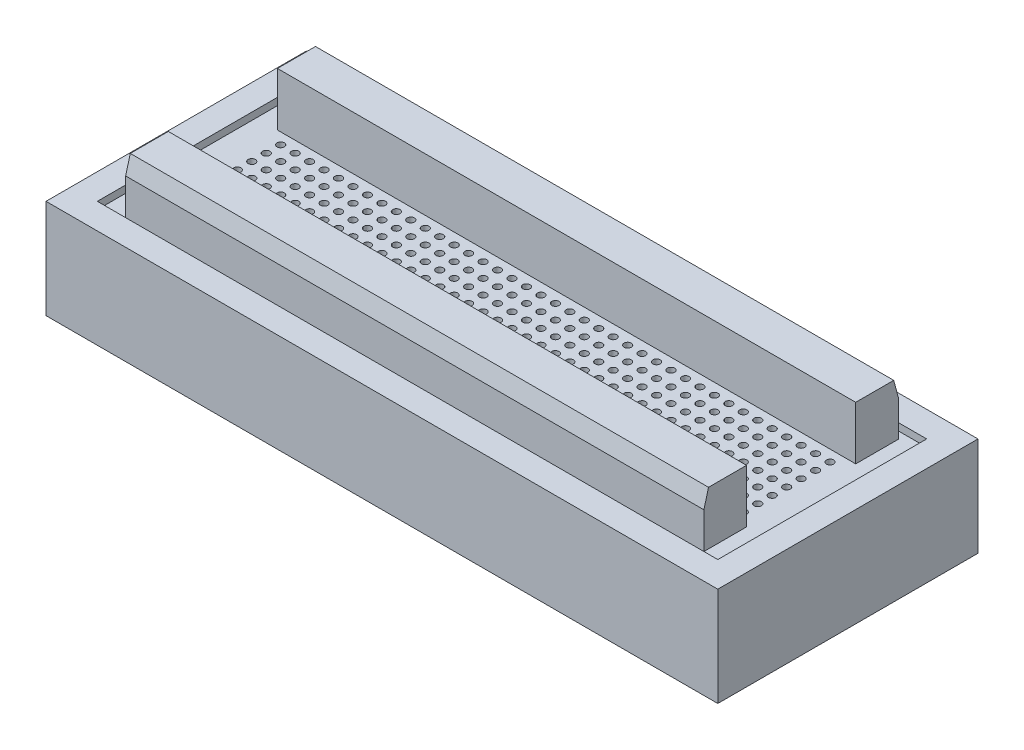
from build123d import *

# Parameters (mm, degrees)
SKETCH1_W               = 118.0338
SKETCH1_H               = 45.72
BOSS_EXTRUDE1_DEPTH     = 17.399
SKETCH2_W               = 109.0168
SKETCH2_H               = 36.703
CUT_EXTRUDE1_DEPTH      = 1.27
BOSS_EXTRUDE2_DEPTH     = 50.8
SKETCH5_W               = 109.0168
SKETCH5_H               = 36.703
CUT_EXTRUDE2_DEPTH      = 66.312469917
SKETCH5_2_W             = 109.0168
SKETCH5_2_H             = 36.703
BOSS_EXTRUDE3_DEPTH     = 16.129
FILL_PATTERN2_OUTLINE_R = 0.635
FILL_PATTERN2_DEPTH     = 16.129


# Read off the part's stored shape, not the designer's step: Fill Pattern2
with BuildPart() as part:
    # Sketch1 → Boss-Extrude1 (new body)
    with BuildSketch(Plane(origin=(0, 0, 0), x_dir=(1, 0, 0), z_dir=(0, 1, 0))):
        Rectangle(SKETCH1_W, SKETCH1_H)
    extrude(amount=BOSS_EXTRUDE1_DEPTH)

    # Sketch2 → Cut-Extrude1 (cut)
    with BuildSketch(Plane(origin=(0, 17.399, 0), x_dir=(1, 0, 0), z_dir=(0, 1, 0))):
        Rectangle(SKETCH2_W, SKETCH2_H)
    extrude(amount=-CUT_EXTRUDE1_DEPTH, mode=Mode.SUBTRACT)

    # Sketch3 → Boss-Extrude2 (add, symmetric)
    with BuildSketch(Plane(origin=(0, 0, 0), x_dir=(0, 0, -1), z_dir=(1, 0, 0))):
        Polygon((-9.5885, 16.129), (-9.5885, 25.5016), (-16.271596771, 25.5016), (-17.0815, 22.479), (-17.0815, 16.129), align=None)
    boss_extrude2 = extrude(amount=BOSS_EXTRUDE2_DEPTH, both=True)

    # Mirror1: Boss-Extrude2 across plane
    add(boss_extrude2.mirror(Plane.XY))

    # Sketch5 → Cut-Extrude2 (cut, through all)
    with BuildSketch(Plane(origin=(0, 16.129, 0), x_dir=(1, 0, 0), z_dir=(0, 1, 0))):
        Rectangle(SKETCH5_W, SKETCH5_H)
    extrude(amount=-CUT_EXTRUDE2_DEPTH, mode=Mode.SUBTRACT)


with BuildPart() as cut_extrude2_piece_1:
    # of the separate pieces the step leaves, piece 1, a body of its own (cut_extrude2_pieces)
    add(part.part.solids().sort_by_distance((-59.0169, 0, 22.86))[0])


with BuildPart() as cut_extrude2_piece_2:
    # of the separate pieces the step leaves, piece 2, a body of its own (cut_extrude2_pieces)
    add(part.part.solids().sort_by_distance((50.8, 16.129, -9.5885))[0])


with BuildPart() as cut_extrude2_piece_3:
    # of the separate pieces the step leaves, piece 3, a body of its own (cut_extrude2_pieces)
    add(part.part.solids().sort_by_distance((-50.8, 16.129, 9.5885))[0])


with BuildPart() as body_4:
    # Sketch5<2> → Boss-Extrude3 (new body)
    with BuildSketch(Plane(origin=(0, 16.129, 0), x_dir=(1, 0, 0), z_dir=(0, 1, 0))):
        Rectangle(SKETCH5_2_W, SKETCH5_2_H)
    extrude(amount=-BOSS_EXTRUDE3_DEPTH)

    # Fill Pattern2 outline → Fill Pattern2 (cut)
    with BuildSketch(Plane(origin=(0, 0, 0), x_dir=(1, 0, 0), z_dir=(0, 1, 0))):
        Circle(FILL_PATTERN2_OUTLINE_R)
        with Locations((-45.72, 5.08)):
            Circle(FILL_PATTERN2_OUTLINE_R)
        with Locations((-45.72, 2.54)):
            Circle(FILL_PATTERN2_OUTLINE_R)
        with Locations((-45.72, 0)):
            Circle(FILL_PATTERN2_OUTLINE_R)
        with Locations((-45.72, -2.54)):
            Circle(FILL_PATTERN2_OUTLINE_R)
        with Locations((-43.18, 5.08)):
            Circle(FILL_PATTERN2_OUTLINE_R)
        with Locations((-45.72, -7.62)):
            Circle(FILL_PATTERN2_OUTLINE_R)
        with Locations((-43.18, 7.62)):
            Circle(FILL_PATTERN2_OUTLINE_R)
        with Locations((-45.72, -5.08)):
            Circle(FILL_PATTERN2_OUTLINE_R)
        with Locations((-48.26, 7.62)):
            Circle(FILL_PATTERN2_OUTLINE_R)
        with Locations((-48.26, 5.08)):
            Circle(FILL_PATTERN2_OUTLINE_R)
        with Locations((-48.26, 2.54)):
            Circle(FILL_PATTERN2_OUTLINE_R)
        with Locations((-48.26, 0)):
            Circle(FILL_PATTERN2_OUTLINE_R)
        with Locations((-48.26, -7.62)):
            Circle(FILL_PATTERN2_OUTLINE_R)
        with Locations((-45.72, 7.62)):
            Circle(FILL_PATTERN2_OUTLINE_R)
        with Locations((-48.26, -5.08)):
            Circle(FILL_PATTERN2_OUTLINE_R)
        with Locations((-48.26, -2.54)):
            Circle(FILL_PATTERN2_OUTLINE_R)
        with Locations((-5.08, -7.62)):
            Circle(FILL_PATTERN2_OUTLINE_R)
        with Locations((20.32, -7.62)):
            Circle(FILL_PATTERN2_OUTLINE_R)
        with Locations((22.86, -5.08)):
            Circle(FILL_PATTERN2_OUTLINE_R)
        with Locations((25.4, -2.54)):
            Circle(FILL_PATTERN2_OUTLINE_R)
        with Locations((27.94, 0)):
            Circle(FILL_PATTERN2_OUTLINE_R)
        with Locations((30.48, 2.54)):
            Circle(FILL_PATTERN2_OUTLINE_R)
        with Locations((33.02, 5.08)):
            Circle(FILL_PATTERN2_OUTLINE_R)
        with Locations((35.56, 7.62)):
            Circle(FILL_PATTERN2_OUTLINE_R)
        with Locations((-5.08, 5.08)):
            Circle(FILL_PATTERN2_OUTLINE_R)
        with Locations((-7.62, -7.62)):
            Circle(FILL_PATTERN2_OUTLINE_R)
        with Locations((22.86, -7.62)):
            Circle(FILL_PATTERN2_OUTLINE_R)
        with Locations((25.4, -5.08)):
            Circle(FILL_PATTERN2_OUTLINE_R)
        with Locations((27.94, -2.54)):
            Circle(FILL_PATTERN2_OUTLINE_R)
        with Locations((30.48, 0)):
            Circle(FILL_PATTERN2_OUTLINE_R)
        with Locations((33.02, 2.54)):
            Circle(FILL_PATTERN2_OUTLINE_R)
        with Locations((35.56, 5.08)):
            Circle(FILL_PATTERN2_OUTLINE_R)
        with Locations((-2.54, -7.62)):
            Circle(FILL_PATTERN2_OUTLINE_R)
        with Locations((-5.08, 0)):
            Circle(FILL_PATTERN2_OUTLINE_R)
        with Locations((30.48, 7.62)):
            Circle(FILL_PATTERN2_OUTLINE_R)
        with Locations((27.94, 5.08)):
            Circle(FILL_PATTERN2_OUTLINE_R)
        with Locations((25.4, 2.54)):
            Circle(FILL_PATTERN2_OUTLINE_R)
        with Locations((22.86, 0)):
            Circle(FILL_PATTERN2_OUTLINE_R)
        with Locations((20.32, -2.54)):
            Circle(FILL_PATTERN2_OUTLINE_R)
        with Locations((17.78, -5.08)):
            Circle(FILL_PATTERN2_OUTLINE_R)
        with Locations((17.78, -7.62)):
            Circle(FILL_PATTERN2_OUTLINE_R)
        with Locations((20.32, -5.08)):
            Circle(FILL_PATTERN2_OUTLINE_R)
        with Locations((22.86, -2.54)):
            Circle(FILL_PATTERN2_OUTLINE_R)
        with Locations((25.4, 0)):
            Circle(FILL_PATTERN2_OUTLINE_R)
        with Locations((-5.08, 2.54)):
            Circle(FILL_PATTERN2_OUTLINE_R)
        with Locations((33.02, 7.62)):
            Circle(FILL_PATTERN2_OUTLINE_R)
        with Locations((30.48, 5.08)):
            Circle(FILL_PATTERN2_OUTLINE_R)
        with Locations((27.94, 2.54)):
            Circle(FILL_PATTERN2_OUTLINE_R)
        with Locations((2.54, 5.08)):
            Circle(FILL_PATTERN2_OUTLINE_R)
        with Locations((43.18, 7.62)):
            Circle(FILL_PATTERN2_OUTLINE_R)
        with Locations((40.64, 5.08)):
            Circle(FILL_PATTERN2_OUTLINE_R)
        with Locations((38.1, 2.54)):
            Circle(FILL_PATTERN2_OUTLINE_R)
        with Locations((-7.62, 0)):
            Circle(FILL_PATTERN2_OUTLINE_R)
        with Locations((30.48, -7.62)):
            Circle(FILL_PATTERN2_OUTLINE_R)
        with Locations((33.02, -5.08)):
            Circle(FILL_PATTERN2_OUTLINE_R)
        with Locations((35.56, -2.54)):
            Circle(FILL_PATTERN2_OUTLINE_R)
        with Locations((38.1, -2.54)):
            Circle(FILL_PATTERN2_OUTLINE_R)
        with Locations((35.56, -5.08)):
            Circle(FILL_PATTERN2_OUTLINE_R)
        with Locations((33.02, -7.62)):
            Circle(FILL_PATTERN2_OUTLINE_R)
        with Locations((-7.62, 2.54)):
            Circle(FILL_PATTERN2_OUTLINE_R)
        with Locations((45.72, 7.62)):
            Circle(FILL_PATTERN2_OUTLINE_R)
        with Locations((43.18, 5.08)):
            Circle(FILL_PATTERN2_OUTLINE_R)
        with Locations((40.64, 2.54)):
            Circle(FILL_PATTERN2_OUTLINE_R)
        with Locations((38.1, 0)):
            Circle(FILL_PATTERN2_OUTLINE_R)
        with Locations((35.56, 2.54)):
            Circle(FILL_PATTERN2_OUTLINE_R)
        with Locations((33.02, 0)):
            Circle(FILL_PATTERN2_OUTLINE_R)
        with Locations((30.48, -2.54)):
            Circle(FILL_PATTERN2_OUTLINE_R)
        with Locations((27.94, -5.08)):
            Circle(FILL_PATTERN2_OUTLINE_R)
        with Locations((25.4, -7.62)):
            Circle(FILL_PATTERN2_OUTLINE_R)
        with Locations((-7.62, -5.08)):
            Circle(FILL_PATTERN2_OUTLINE_R)
        with Locations((-2.54, 5.08)):
            Circle(FILL_PATTERN2_OUTLINE_R)
        with Locations((38.1, 7.62)):
            Circle(FILL_PATTERN2_OUTLINE_R)
        with Locations((35.56, 0)):
            Circle(FILL_PATTERN2_OUTLINE_R)
        with Locations((33.02, -2.54)):
            Circle(FILL_PATTERN2_OUTLINE_R)
        with Locations((30.48, -5.08)):
            Circle(FILL_PATTERN2_OUTLINE_R)
        with Locations((27.94, -7.62)):
            Circle(FILL_PATTERN2_OUTLINE_R)
        with Locations((-7.62, -2.54)):
            Circle(FILL_PATTERN2_OUTLINE_R)
        with Locations((0, 5.08)):
            Circle(FILL_PATTERN2_OUTLINE_R)
        with Locations((40.64, 7.62)):
            Circle(FILL_PATTERN2_OUTLINE_R)
        with Locations((38.1, 5.08)):
            Circle(FILL_PATTERN2_OUTLINE_R)
        with Locations((15.24, 5.08)):
            Circle(FILL_PATTERN2_OUTLINE_R)
        with Locations((12.7, 2.54)):
            Circle(FILL_PATTERN2_OUTLINE_R)
        with Locations((10.16, 0)):
            Circle(FILL_PATTERN2_OUTLINE_R)
        with Locations((7.62, -2.54)):
            Circle(FILL_PATTERN2_OUTLINE_R)
        with Locations((5.08, -5.08)):
            Circle(FILL_PATTERN2_OUTLINE_R)
        with Locations((-2.54, -2.54)):
            Circle(FILL_PATTERN2_OUTLINE_R)
        with Locations((15.24, 7.62)):
            Circle(FILL_PATTERN2_OUTLINE_R)
        with Locations((12.7, 5.08)):
            Circle(FILL_PATTERN2_OUTLINE_R)
        with Locations((17.78, 5.08)):
            Circle(FILL_PATTERN2_OUTLINE_R)
        with Locations((15.24, 2.54)):
            Circle(FILL_PATTERN2_OUTLINE_R)
        with Locations((12.7, 0)):
            Circle(FILL_PATTERN2_OUTLINE_R)
        with Locations((10.16, -2.54)):
            Circle(FILL_PATTERN2_OUTLINE_R)
        with Locations((7.62, -5.08)):
            Circle(FILL_PATTERN2_OUTLINE_R)
        with Locations((2.54, -5.08)):
            Circle(FILL_PATTERN2_OUTLINE_R)
        with Locations((-2.54, 0)):
            Circle(FILL_PATTERN2_OUTLINE_R)
        with Locations((17.78, 7.62)):
            Circle(FILL_PATTERN2_OUTLINE_R)
        with Locations((5.08, 2.54)):
            Circle(FILL_PATTERN2_OUTLINE_R)
        with Locations((7.62, 5.08)):
            Circle(FILL_PATTERN2_OUTLINE_R)
        with Locations((10.16, 7.62)):
            Circle(FILL_PATTERN2_OUTLINE_R)
        with Locations((2.54, -2.54)):
            Circle(FILL_PATTERN2_OUTLINE_R)
        with Locations((2.54, 2.54)):
            Circle(FILL_PATTERN2_OUTLINE_R)
        with Locations((5.08, 5.08)):
            Circle(FILL_PATTERN2_OUTLINE_R)
        with Locations((7.62, 7.62)):
            Circle(FILL_PATTERN2_OUTLINE_R)
        with Locations((2.54, 0)):
            Circle(FILL_PATTERN2_OUTLINE_R)
        with Locations((10.16, 2.54)):
            Circle(FILL_PATTERN2_OUTLINE_R)
        with Locations((7.62, 0)):
            Circle(FILL_PATTERN2_OUTLINE_R)
        with Locations((5.08, -2.54)):
            Circle(FILL_PATTERN2_OUTLINE_R)
        with Locations((0, -2.54)):
            Circle(FILL_PATTERN2_OUTLINE_R)
        with Locations((12.7, 7.62)):
            Circle(FILL_PATTERN2_OUTLINE_R)
        with Locations((10.16, 5.08)):
            Circle(FILL_PATTERN2_OUTLINE_R)
        with Locations((7.62, 2.54)):
            Circle(FILL_PATTERN2_OUTLINE_R)
        with Locations((5.08, 0)):
            Circle(FILL_PATTERN2_OUTLINE_R)
        with Locations((17.78, 0)):
            Circle(FILL_PATTERN2_OUTLINE_R)
        with Locations((20.32, 2.54)):
            Circle(FILL_PATTERN2_OUTLINE_R)
        with Locations((22.86, 5.08)):
            Circle(FILL_PATTERN2_OUTLINE_R)
        with Locations((25.4, 7.62)):
            Circle(FILL_PATTERN2_OUTLINE_R)
        with Locations((-5.08, -5.08)):
            Circle(FILL_PATTERN2_OUTLINE_R)
        with Locations((2.54, -7.62)):
            Circle(FILL_PATTERN2_OUTLINE_R)
        with Locations((12.7, -7.62)):
            Circle(FILL_PATTERN2_OUTLINE_R)
        with Locations((15.24, -5.08)):
            Circle(FILL_PATTERN2_OUTLINE_R)
        with Locations((15.24, -7.62)):
            Circle(FILL_PATTERN2_OUTLINE_R)
        with Locations((0, -7.62)):
            Circle(FILL_PATTERN2_OUTLINE_R)
        with Locations((-5.08, -2.54)):
            Circle(FILL_PATTERN2_OUTLINE_R)
        with Locations((27.94, 7.62)):
            Circle(FILL_PATTERN2_OUTLINE_R)
        with Locations((25.4, 5.08)):
            Circle(FILL_PATTERN2_OUTLINE_R)
        with Locations((22.86, 2.54)):
            Circle(FILL_PATTERN2_OUTLINE_R)
        with Locations((20.32, 0)):
            Circle(FILL_PATTERN2_OUTLINE_R)
        with Locations((17.78, -2.54)):
            Circle(FILL_PATTERN2_OUTLINE_R)
        with Locations((17.78, 2.54)):
            Circle(FILL_PATTERN2_OUTLINE_R)
        with Locations((15.24, 0)):
            Circle(FILL_PATTERN2_OUTLINE_R)
        with Locations((12.7, -2.54)):
            Circle(FILL_PATTERN2_OUTLINE_R)
        with Locations((10.16, -5.08)):
            Circle(FILL_PATTERN2_OUTLINE_R)
        with Locations((7.62, -7.62)):
            Circle(FILL_PATTERN2_OUTLINE_R)
        with Locations((0, -5.08)):
            Circle(FILL_PATTERN2_OUTLINE_R)
        with Locations((-2.54, 2.54)):
            Circle(FILL_PATTERN2_OUTLINE_R)
        with Locations((20.32, 7.62)):
            Circle(FILL_PATTERN2_OUTLINE_R)
        with Locations((15.24, -2.54)):
            Circle(FILL_PATTERN2_OUTLINE_R)
        with Locations((12.7, -5.08)):
            Circle(FILL_PATTERN2_OUTLINE_R)
        with Locations((10.16, -7.62)):
            Circle(FILL_PATTERN2_OUTLINE_R)
        with Locations((5.08, -7.62)):
            Circle(FILL_PATTERN2_OUTLINE_R)
        with Locations((-2.54, -5.08)):
            Circle(FILL_PATTERN2_OUTLINE_R)
        with Locations((0, 2.54)):
            Circle(FILL_PATTERN2_OUTLINE_R)
        with Locations((22.86, 7.62)):
            Circle(FILL_PATTERN2_OUTLINE_R)
        with Locations((20.32, 5.08)):
            Circle(FILL_PATTERN2_OUTLINE_R)
        with Locations((-27.94, 0)):
            Circle(FILL_PATTERN2_OUTLINE_R)
        with Locations((-27.94, 2.54)):
            Circle(FILL_PATTERN2_OUTLINE_R)
        with Locations((-27.94, 5.08)):
            Circle(FILL_PATTERN2_OUTLINE_R)
        with Locations((-30.48, -7.62)):
            Circle(FILL_PATTERN2_OUTLINE_R)
        with Locations((-27.94, -7.62)):
            Circle(FILL_PATTERN2_OUTLINE_R)
        with Locations((-25.4, 7.62)):
            Circle(FILL_PATTERN2_OUTLINE_R)
        with Locations((-27.94, -5.08)):
            Circle(FILL_PATTERN2_OUTLINE_R)
        with Locations((-27.94, -2.54)):
            Circle(FILL_PATTERN2_OUTLINE_R)
        with Locations((-30.48, 2.54)):
            Circle(FILL_PATTERN2_OUTLINE_R)
        with Locations((-30.48, 5.08)):
            Circle(FILL_PATTERN2_OUTLINE_R)
        with Locations((-33.02, -7.62)):
            Circle(FILL_PATTERN2_OUTLINE_R)
        with Locations((-30.48, 7.62)):
            Circle(FILL_PATTERN2_OUTLINE_R)
        with Locations((-27.94, 7.62)):
            Circle(FILL_PATTERN2_OUTLINE_R)
        with Locations((-30.48, -5.08)):
            Circle(FILL_PATTERN2_OUTLINE_R)
        with Locations((-30.48, -2.54)):
            Circle(FILL_PATTERN2_OUTLINE_R)
        with Locations((-30.48, 0)):
            Circle(FILL_PATTERN2_OUTLINE_R)
        with Locations((-22.86, 2.54)):
            Circle(FILL_PATTERN2_OUTLINE_R)
        with Locations((-22.86, 0)):
            Circle(FILL_PATTERN2_OUTLINE_R)
        with Locations((-22.86, -2.54)):
            Circle(FILL_PATTERN2_OUTLINE_R)
        with Locations((-22.86, -5.08)):
            Circle(FILL_PATTERN2_OUTLINE_R)
        with Locations((-20.32, 2.54)):
            Circle(FILL_PATTERN2_OUTLINE_R)
        with Locations((-20.32, 5.08)):
            Circle(FILL_PATTERN2_OUTLINE_R)
        with Locations((-22.86, -7.62)):
            Circle(FILL_PATTERN2_OUTLINE_R)
        with Locations((-20.32, 7.62)):
            Circle(FILL_PATTERN2_OUTLINE_R)
        with Locations((-25.4, 5.08)):
            Circle(FILL_PATTERN2_OUTLINE_R)
        with Locations((-25.4, 2.54)):
            Circle(FILL_PATTERN2_OUTLINE_R)
        with Locations((-25.4, 0)):
            Circle(FILL_PATTERN2_OUTLINE_R)
        with Locations((-25.4, -2.54)):
            Circle(FILL_PATTERN2_OUTLINE_R)
        with Locations((-22.86, 5.08)):
            Circle(FILL_PATTERN2_OUTLINE_R)
        with Locations((-25.4, -7.62)):
            Circle(FILL_PATTERN2_OUTLINE_R)
        with Locations((-22.86, 7.62)):
            Circle(FILL_PATTERN2_OUTLINE_R)
        with Locations((-25.4, -5.08)):
            Circle(FILL_PATTERN2_OUTLINE_R)
        with Locations((-38.1, 7.62)):
            Circle(FILL_PATTERN2_OUTLINE_R)
        with Locations((-40.64, -5.08)):
            Circle(FILL_PATTERN2_OUTLINE_R)
        with Locations((-40.64, -2.54)):
            Circle(FILL_PATTERN2_OUTLINE_R)
        with Locations((-40.64, 0)):
            Circle(FILL_PATTERN2_OUTLINE_R)
        with Locations((-38.1, 0)):
            Circle(FILL_PATTERN2_OUTLINE_R)
        with Locations((-38.1, 2.54)):
            Circle(FILL_PATTERN2_OUTLINE_R)
        with Locations((-38.1, 5.08)):
            Circle(FILL_PATTERN2_OUTLINE_R)
        with Locations((-40.64, -7.62)):
            Circle(FILL_PATTERN2_OUTLINE_R)
        with Locations((-43.18, 2.54)):
            Circle(FILL_PATTERN2_OUTLINE_R)
        with Locations((-43.18, 0)):
            Circle(FILL_PATTERN2_OUTLINE_R)
        with Locations((-43.18, -2.54)):
            Circle(FILL_PATTERN2_OUTLINE_R)
        with Locations((-43.18, -5.08)):
            Circle(FILL_PATTERN2_OUTLINE_R)
        with Locations((-40.64, 2.54)):
            Circle(FILL_PATTERN2_OUTLINE_R)
        with Locations((-40.64, 5.08)):
            Circle(FILL_PATTERN2_OUTLINE_R)
        with Locations((-43.18, -7.62)):
            Circle(FILL_PATTERN2_OUTLINE_R)
        with Locations((-40.64, 7.62)):
            Circle(FILL_PATTERN2_OUTLINE_R)
        with Locations((-33.02, 5.08)):
            Circle(FILL_PATTERN2_OUTLINE_R)
        with Locations((-35.56, -7.62)):
            Circle(FILL_PATTERN2_OUTLINE_R)
        with Locations((-33.02, 7.62)):
            Circle(FILL_PATTERN2_OUTLINE_R)
        with Locations((-35.56, -5.08)):
            Circle(FILL_PATTERN2_OUTLINE_R)
        with Locations((-33.02, 2.54)):
            Circle(FILL_PATTERN2_OUTLINE_R)
        with Locations((-33.02, 0)):
            Circle(FILL_PATTERN2_OUTLINE_R)
        with Locations((-33.02, -2.54)):
            Circle(FILL_PATTERN2_OUTLINE_R)
        with Locations((-33.02, -5.08)):
            Circle(FILL_PATTERN2_OUTLINE_R)
        with Locations((-38.1, -7.62)):
            Circle(FILL_PATTERN2_OUTLINE_R)
        with Locations((-35.56, 7.62)):
            Circle(FILL_PATTERN2_OUTLINE_R)
        with Locations((-38.1, -5.08)):
            Circle(FILL_PATTERN2_OUTLINE_R)
        with Locations((-38.1, -2.54)):
            Circle(FILL_PATTERN2_OUTLINE_R)
        with Locations((-35.56, 5.08)):
            Circle(FILL_PATTERN2_OUTLINE_R)
        with Locations((-35.56, 2.54)):
            Circle(FILL_PATTERN2_OUTLINE_R)
        with Locations((-35.56, 0)):
            Circle(FILL_PATTERN2_OUTLINE_R)
        with Locations((-35.56, -2.54)):
            Circle(FILL_PATTERN2_OUTLINE_R)
        with Locations((45.72, -2.54)):
            Circle(FILL_PATTERN2_OUTLINE_R)
        with Locations((43.18, -5.08)):
            Circle(FILL_PATTERN2_OUTLINE_R)
        with Locations((40.64, -7.62)):
            Circle(FILL_PATTERN2_OUTLINE_R)
        with Locations((-10.16, -2.54)):
            Circle(FILL_PATTERN2_OUTLINE_R)
        with Locations((-5.08, 7.62)):
            Circle(FILL_PATTERN2_OUTLINE_R)
        with Locations((48.26, 2.54)):
            Circle(FILL_PATTERN2_OUTLINE_R)
        with Locations((45.72, 0)):
            Circle(FILL_PATTERN2_OUTLINE_R)
        with Locations((43.18, -2.54)):
            Circle(FILL_PATTERN2_OUTLINE_R)
        with Locations((-10.16, 2.54)):
            Circle(FILL_PATTERN2_OUTLINE_R)
        with Locations((0, 7.62)):
            Circle(FILL_PATTERN2_OUTLINE_R)
        with Locations((48.26, -2.54)):
            Circle(FILL_PATTERN2_OUTLINE_R)
        with Locations((45.72, -5.08)):
            Circle(FILL_PATTERN2_OUTLINE_R)
        with Locations((48.26, 0)):
            Circle(FILL_PATTERN2_OUTLINE_R)
        with Locations((-2.54, 7.62)):
            Circle(FILL_PATTERN2_OUTLINE_R)
        with Locations((-10.16, 0)):
            Circle(FILL_PATTERN2_OUTLINE_R)
        with Locations((43.18, -7.62)):
            Circle(FILL_PATTERN2_OUTLINE_R)
        with Locations((40.64, 0)):
            Circle(FILL_PATTERN2_OUTLINE_R)
        with Locations((43.18, 2.54)):
            Circle(FILL_PATTERN2_OUTLINE_R)
        with Locations((45.72, 5.08)):
            Circle(FILL_PATTERN2_OUTLINE_R)
        with Locations((48.26, 7.62)):
            Circle(FILL_PATTERN2_OUTLINE_R)
        with Locations((-7.62, 5.08)):
            Circle(FILL_PATTERN2_OUTLINE_R)
        with Locations((-10.16, -7.62)):
            Circle(FILL_PATTERN2_OUTLINE_R)
        with Locations((35.56, -7.62)):
            Circle(FILL_PATTERN2_OUTLINE_R)
        with Locations((38.1, -5.08)):
            Circle(FILL_PATTERN2_OUTLINE_R)
        with Locations((40.64, -5.08)):
            Circle(FILL_PATTERN2_OUTLINE_R)
        with Locations((38.1, -7.62)):
            Circle(FILL_PATTERN2_OUTLINE_R)
        with Locations((-10.16, -5.08)):
            Circle(FILL_PATTERN2_OUTLINE_R)
        with Locations((-7.62, 7.62)):
            Circle(FILL_PATTERN2_OUTLINE_R)
        with Locations((48.26, 5.08)):
            Circle(FILL_PATTERN2_OUTLINE_R)
        with Locations((45.72, 2.54)):
            Circle(FILL_PATTERN2_OUTLINE_R)
        with Locations((43.18, 0)):
            Circle(FILL_PATTERN2_OUTLINE_R)
        with Locations((40.64, -2.54)):
            Circle(FILL_PATTERN2_OUTLINE_R)
        with Locations((-17.78, -7.62)):
            Circle(FILL_PATTERN2_OUTLINE_R)
        with Locations((-15.24, 7.62)):
            Circle(FILL_PATTERN2_OUTLINE_R)
        with Locations((-17.78, -5.08)):
            Circle(FILL_PATTERN2_OUTLINE_R)
        with Locations((-17.78, -2.54)):
            Circle(FILL_PATTERN2_OUTLINE_R)
        with Locations((-15.24, 5.08)):
            Circle(FILL_PATTERN2_OUTLINE_R)
        with Locations((-15.24, 2.54)):
            Circle(FILL_PATTERN2_OUTLINE_R)
        with Locations((-15.24, 0)):
            Circle(FILL_PATTERN2_OUTLINE_R)
        with Locations((-15.24, -2.54)):
            Circle(FILL_PATTERN2_OUTLINE_R)
        with Locations((-17.78, 7.62)):
            Circle(FILL_PATTERN2_OUTLINE_R)
        with Locations((-20.32, -5.08)):
            Circle(FILL_PATTERN2_OUTLINE_R)
        with Locations((-20.32, -2.54)):
            Circle(FILL_PATTERN2_OUTLINE_R)
        with Locations((-20.32, 0)):
            Circle(FILL_PATTERN2_OUTLINE_R)
        with Locations((-17.78, 0)):
            Circle(FILL_PATTERN2_OUTLINE_R)
        with Locations((-17.78, 2.54)):
            Circle(FILL_PATTERN2_OUTLINE_R)
        with Locations((-17.78, 5.08)):
            Circle(FILL_PATTERN2_OUTLINE_R)
        with Locations((-20.32, -7.62)):
            Circle(FILL_PATTERN2_OUTLINE_R)
        with Locations((-10.16, 7.62)):
            Circle(FILL_PATTERN2_OUTLINE_R)
        with Locations((5.08, 7.62)):
            Circle(FILL_PATTERN2_OUTLINE_R)
        with Locations((48.26, -7.62)):
            Circle(FILL_PATTERN2_OUTLINE_R)
        with Locations((-12.7, -7.62)):
            Circle(FILL_PATTERN2_OUTLINE_R)
        with Locations((-10.16, 5.08)):
            Circle(FILL_PATTERN2_OUTLINE_R)
        with Locations((2.54, 7.62)):
            Circle(FILL_PATTERN2_OUTLINE_R)
        with Locations((48.26, -5.08)):
            Circle(FILL_PATTERN2_OUTLINE_R)
        with Locations((45.72, -7.62)):
            Circle(FILL_PATTERN2_OUTLINE_R)
        with Locations((-12.7, 5.08)):
            Circle(FILL_PATTERN2_OUTLINE_R)
        with Locations((-15.24, -7.62)):
            Circle(FILL_PATTERN2_OUTLINE_R)
        with Locations((-12.7, 7.62)):
            Circle(FILL_PATTERN2_OUTLINE_R)
        with Locations((-15.24, -5.08)):
            Circle(FILL_PATTERN2_OUTLINE_R)
        with Locations((-12.7, 2.54)):
            Circle(FILL_PATTERN2_OUTLINE_R)
        with Locations((-12.7, 0)):
            Circle(FILL_PATTERN2_OUTLINE_R)
        with Locations((-12.7, -2.54)):
            Circle(FILL_PATTERN2_OUTLINE_R)
        with Locations((-12.7, -5.08)):
            Circle(FILL_PATTERN2_OUTLINE_R)
    extrude(amount=FILL_PATTERN2_DEPTH, mode=Mode.SUBTRACT)


solid = Compound([cut_extrude2_piece_1.part, cut_extrude2_piece_2.part, cut_extrude2_piece_3.part, body_4.part])
